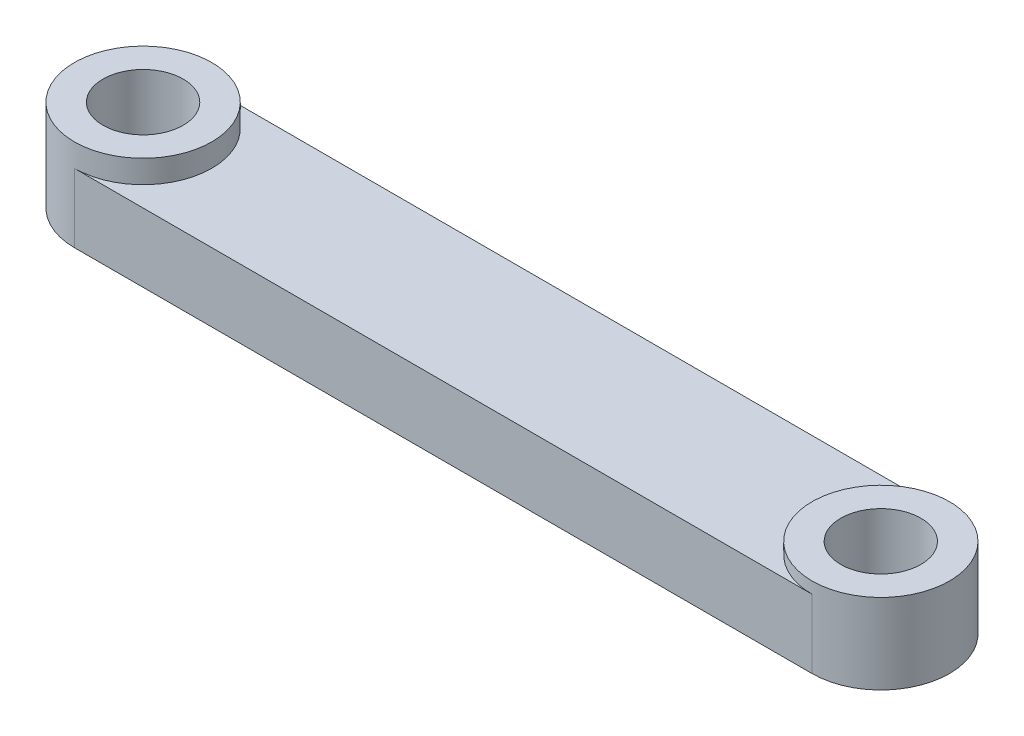
from build123d import *
from build123d.topology import SkipClean

# Parameters (mm, degrees)
EXTRUDE_1_DEPTH     = 3
SKETCH_2_R          = 3
EXTRUDE_2_DEPTH     = 0.5
SKETCH_3_R          = 3
EXTRUDE_3_DEPTH     = 1
SKETCH_4_R          = 1.75
CUT_EXTRUDE_1_DEPTH = 36.553340209


with BuildPart() as part:
    # Эскиз1 → Бобышка-Вытянуть1 (new body)
    with BuildSketch(Plane(origin=(0, 0, 0), x_dir=(1, 0, 0), z_dir=(0, 1, 0))):
        with BuildLine():
            Line((0, 3), (32.2, 3))
            ThreePointArc((32.2, 3), (35.2, 0), (32.2, -3))
            Line((32.2, -3), (0, -3))
            ThreePointArc((0, -3), (-3, 0), (0, 3))
        make_face()
    extrude(amount=EXTRUDE_1_DEPTH)

    # Эскиз2 → Бобышка-Вытянуть2 (add)
    with SkipClean():  # the faces are left unmerged after this step: merging them gives an invalid solid
        with BuildSketch(Plane(origin=(0, 3, 0), x_dir=(1, 0, 0), z_dir=(0, 1, 0))):
            with Locations((32.2, 0)):
                Circle(SKETCH_2_R)
        extrude(amount=EXTRUDE_2_DEPTH)
    add(part.part.scale(1), mode=Mode.REPLACE)  # the faces are merged on a copy

    # Эскиз3 → Бобышка-Вытянуть3 (add)
    with BuildSketch(Plane(origin=(0, 3, 0), x_dir=(1, 0, 0), z_dir=(0, 1, 0))):
        Circle(SKETCH_3_R)
    extrude(amount=EXTRUDE_3_DEPTH)

    # Эскиз4 → Вырез-Вытянуть1 (cut, through all)
    with BuildSketch(Plane(origin=(0, 4, 0), x_dir=(1, 0, 0), z_dir=(0, 1, 0))):
        Circle(SKETCH_4_R)
        with Locations((32.2, 0)):
            Circle(SKETCH_4_R)
    extrude(amount=-CUT_EXTRUDE_1_DEPTH, mode=Mode.SUBTRACT)


solid = part.part
